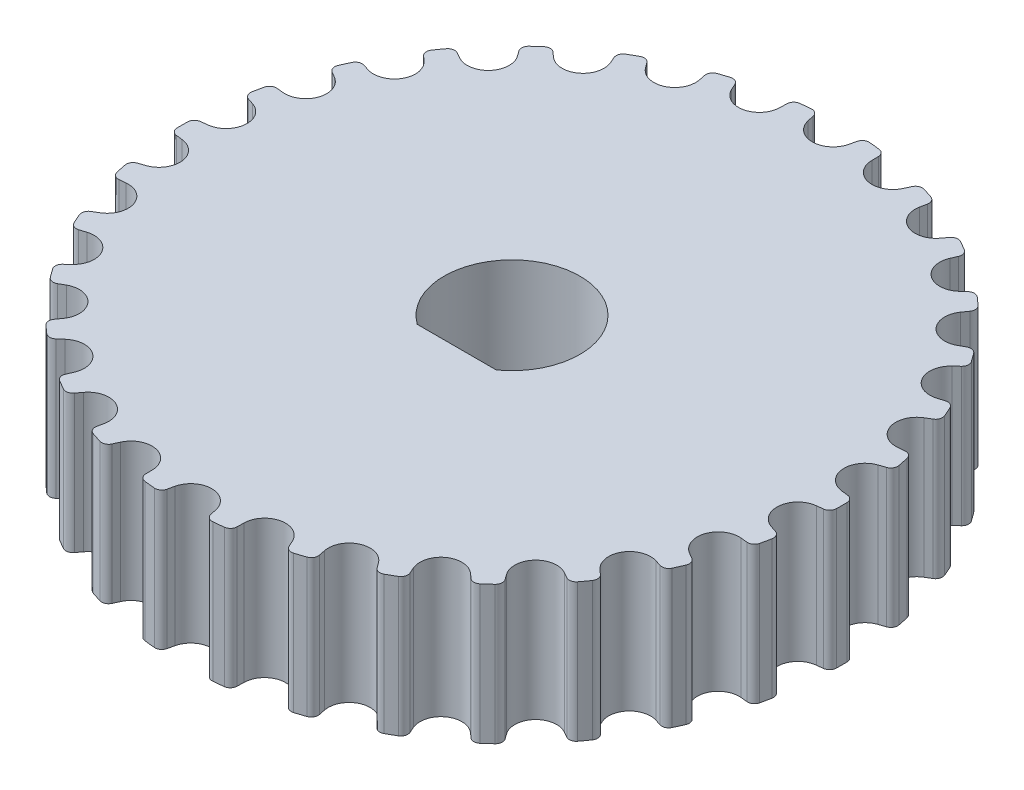
from build123d import *

# Parameters (mm, degrees)
SKETCH1_R           = 14.323944878
BOSS_EXTRUDE1_DEPTH = 6
CUT_EXTRUDE1_DEPTH  = 22.127015732
CIRPATTERN1_COUNT   = 30
CUT_EXTRUDE2_DEPTH  = 22.08964236


with BuildPart() as part:
    # Sketch1 → Boss-Extrude1 (new body)
    with BuildSketch(Plane(origin=(0, 0, 0), x_dir=(1, 0, 0), z_dir=(0, 1, 0))):
        Circle(SKETCH1_R)
    extrude(amount=BOSS_EXTRUDE1_DEPTH)

    # Sketch2 → Cut-Extrude1 (cut, through all)
    with BuildSketch(Plane(origin=(0, 6, 0), x_dir=(1, 0, 0), z_dir=(0, 1, 0))):
        with BuildLine():
            Line((-0.88830444, 13.756422166), (-0.95, 14.033881093))
            ThreePointArc((-0.95, 14.033881093), (-1.065709647, 14.210883809), (-1.269434594, 14.267583281))
            ThreePointArc((-1.269434594, 14.267583281), (-2.127648488, 14.165045315), (-2.978115599, 14.010932316))
            Line((-2.978115599, 14.010932316), (-2.978115599, 14.323944878))
            Line((-2.978115599, 14.323944878), (2.978115599, 14.323944878))
            Line((2.978115599, 14.323944878), (2.978115599, 14.010932316))
            ThreePointArc((2.978115599, 14.010932316), (2.127648488, 14.165045315), (1.269434594, 14.267583281))
            ThreePointArc((1.269434594, 14.267583281), (1.065709647, 14.210883809), (0.95, 14.033881093))
            Line((0.95, 14.033881093), (0.88830444, 13.756422166))
            ThreePointArc((0.88830444, 13.756422166), (0, 13.043944878), (-0.88830444, 13.756422166))
        make_face()
    cut_extrude1 = extrude(amount=-CUT_EXTRUDE1_DEPTH, mode=Mode.SUBTRACT)

    # CirPattern1: Cut-Extrude1 ×30 about axis
    cirpattern1_axis = Axis((0, 6, 0), (0, -1, 0))
    for i in range(1, CIRPATTERN1_COUNT):
        add(cut_extrude1.rotate(cirpattern1_axis, i * 360 / CIRPATTERN1_COUNT), mode=Mode.SUBTRACT)

    # Sketch3 → Cut-Extrude2 (cut, through all)
    with BuildSketch(Plane.XZ):
        with BuildLine():
            Line((1.71537168, 2.4), (-1.71537168, 2.4))
            ThreePointArc((-1.71537168, 2.4), (0, -2.95), (1.71537168, 2.4))
        make_face()
    extrude(amount=-CUT_EXTRUDE2_DEPTH, mode=Mode.SUBTRACT)


solid = part.part
